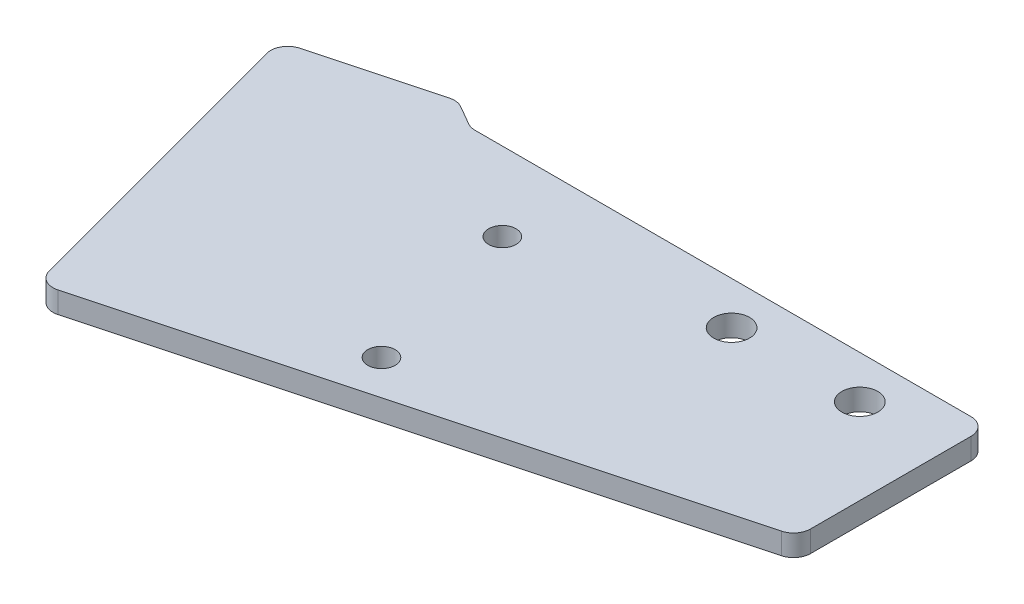
from build123d import *

# Parameters (mm, degrees)
SKETCH_1_W          = 35
SKETCH_1_H          = 10
SKETCH_1_R          = 2.1
EXTRUDE_1_DEPTH     = 2.5
EXTRUDE_2_DEPTH     = 2.5
SKETCH_2_3_R        = 1.6
CUT_EXTRUDE_1_DEPTH = 73.650942584
CHAMFER_1_SIZE      = 24.494897428
CHAMFER_1_SIZE_2    = 30
FILLET_1_R          = 2


with BuildPart() as part:
    # 草图1 → 凸台-拉伸1 (new body)
    with BuildSketch(Plane(origin=(0, 0, 0), x_dir=(1, 0, 0), z_dir=(0, 1, 0))):
        Rectangle(SKETCH_1_W, SKETCH_1_H)
        with Locations(Location((-7.5, 0, 0), (0, 0, 270))):
            Circle(SKETCH_1_R, mode=Mode.SUBTRACT)
        with Locations(Location((7.5, 0, 0), (0, 0, 270))):
            Circle(SKETCH_1_R, mode=Mode.SUBTRACT)
    extrude(amount=EXTRUDE_1_DEPTH)

    # 草图2 → 凸台-拉伸2 (add)
    with BuildSketch(Plane(origin=(0, 2.5, 0), x_dir=(1, 0, 0), z_dir=(0, 1, 0))):
        Polygon((-63.004240202, 2.548597579), (-52.651478398, -36.088435473), (17.5, -17.291403488), (17.5, -5), (-17.5, -5), (-17.5, 14.741421993), align=None)
    extrude(amount=-EXTRUDE_2_DEPTH)

    # 草图2<3> → 切除-拉伸1 (cut, through all)
    with BuildSketch(Plane(origin=(0, 2.5, 0), x_dir=(1, 0, 0), z_dir=(0, 1, 0))):
        with Locations(Location((-30.144179737, -4.175718463, 0), (0, 0, 270))):
            Circle(SKETCH_2_3_R)
        with Locations(Location((-24.967798835, -23.494234988, 0), (0, 0, 270))):
            Circle(SKETCH_2_3_R)
    extrude(amount=-CUT_EXTRUDE_1_DEPTH, mode=Mode.SUBTRACT)

    # 倒角1
    # the kernel refuses this chamfer: 30, 24.494897428 mm, written as the material it takes off along each edge
    with BuildSketch(Plane(origin=(-17.5, 79.650489639, -14.741421993), x_dir=(0.04137655931612181, 0, 0.999143623479207), z_dir=(0, -1, 0))) as chamfer_1_piece_1_section:
        Polygon((CHAMFER_1_SIZE * 0.999143623472, CHAMFER_1_SIZE * 0.0413765593158), (CHAMFER_1_SIZE_2 * 0.218630711303, CHAMFER_1_SIZE_2 * 0.975807671662), (0, 0), align=None)
    chamfer_1_piece_1 = extrude(amount=156.800979278, mode=Mode.PRIVATE)
    chamfer_1_piece_1 = split(chamfer_1_piece_1, bisect_by=Plane(origin=(-28.937603514, 1.25, -5), z_dir=(0, 0, -1)), keep=Keep.TOP, mode=Mode.PRIVATE)
    add(chamfer_1_piece_1, mode=Mode.SUBTRACT)

    # 圆角1
    fillet_1_edges = [part.edges().sort_by_distance(p)[0] for p in [
        (17.5, 1.25, 17.291403488),
        (-52.651478398, 1.25, 36.088435473),
        (-63.004240202, 1.25, -2.548597579),
        (-46.477774789, 1.25, -6.97685064),
        (-43.053769041, 1.25, -5),
        (17.5, 1.25, -5),
    ]]
    fillet(fillet_1_edges, radius=FILLET_1_R)


solid = part.part
